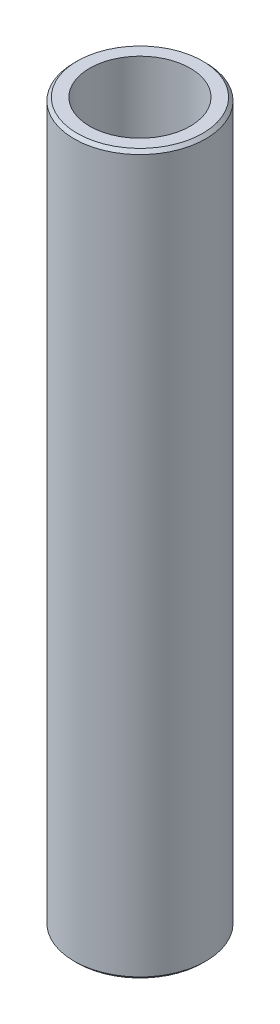
from build123d import *

# Parameters (mm, degrees)
SKETCH1_R           = 55
BOSS_EXTRUDE1_DEPTH = 600
SKETCH2_R           = 41.992161021
CUT_EXTRUDE1_DEPTH  = 606.020660804
CHAMFER1_SIZE       = 2.634181541


with BuildPart() as part:
    # Sketch1 → Boss-Extrude1 (new body)
    with BuildSketch(Plane(origin=(0, 0, 0), x_dir=(1, 0, 0), z_dir=(0, 1, 0))):
        Circle(SKETCH1_R)
    extrude(amount=BOSS_EXTRUDE1_DEPTH)

    # Sketch2 → Cut-Extrude1 (cut, through all)
    with BuildSketch(Plane(origin=(0, 0, 0), x_dir=(1, 0, 0), z_dir=(0, 1, 0))):
        Circle(SKETCH2_R)
    extrude(amount=CUT_EXTRUDE1_DEPTH, mode=Mode.SUBTRACT)

    # Chamfer1
    chamfer1_edges = [part.edges().sort_by_distance(p)[0] for p in [
        (-55, 600, 0),
        (-55, 0, 0),
    ]]
    chamfer(chamfer1_edges, length=CHAMFER1_SIZE)


solid = part.part
